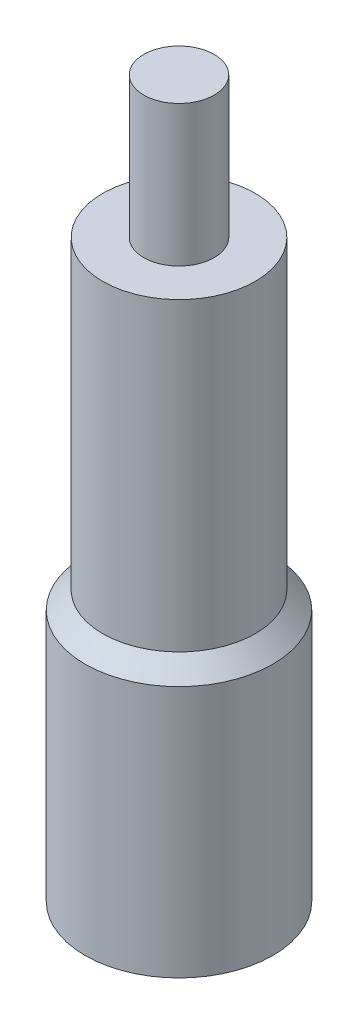
from build123d import *

# Parameters (mm, degrees)
SKETCH_1_R             = 4
EXTRUDE_1_DEPTH        = 24.5
SKETCH_2_R             = 1.5
EXTRUDE_2_DEPTH        = 6
HOLE_WIZARD_M5_1_D     = 4.2
HOLE_WIZARD_M5_1_DEPTH = 10
HOLE_WIZARD_M5_1_TIP   = 1.2618073
SKETCH_5_OUTSIDE_W     = 16.506
SKETCH_5_OUTSIDE_H     = 16.506
SKETCH_5_OUTSIDE_R     = 3.25
CUT_EXTRUDE_1_DEPTH    = 13
CHAMFER_1_SIZE         = 0.75


with BuildPart() as part:
    # 草图1 → 凸台-拉伸1 (new body)
    with BuildSketch(Plane(origin=(0, 0, 0), x_dir=(1, 0, 0), z_dir=(0, 1, 0))):
        with Locations(Location((0, 0, 0), (0, 0, 270))):
            Circle(SKETCH_1_R)
    extrude(amount=EXTRUDE_1_DEPTH)

    # 草图2 → 凸台-拉伸2 (add)
    with BuildSketch(Plane(origin=(0, 24.5, 0), x_dir=(1, 0, 0), z_dir=(0, 1, 0))):
        with Locations(Location((0, 0, 0), (0, 0, 270))):
            Circle(SKETCH_2_R)
    extrude(amount=EXTRUDE_2_DEPTH)

    # M5 螺纹孔1
    with Locations(Plane(origin=(0, 0, 0), x_dir=(-1, 0, 0), z_dir=(0, -1, 0))):
        with Locations((0, 0)):
            Hole(HOLE_WIZARD_M5_1_D / 2, depth=HOLE_WIZARD_M5_1_DEPTH)
            with Locations((0, 0, -(HOLE_WIZARD_M5_1_DEPTH + HOLE_WIZARD_M5_1_TIP / 2))):  # 118° drill point
                Cone(0, HOLE_WIZARD_M5_1_D / 2, HOLE_WIZARD_M5_1_TIP, mode=Mode.SUBTRACT)

    # 草图5 outside → 切除-拉伸1 (cut)
    with BuildSketch(Plane(origin=(0, 24.5, 0), x_dir=(1, 0, 0), z_dir=(0, 1, 0))):
        Rectangle(SKETCH_5_OUTSIDE_W, SKETCH_5_OUTSIDE_H)
        with Locations(Location((0, 0, 0), (0, 0, 270))):
            Circle(SKETCH_5_OUTSIDE_R, mode=Mode.SUBTRACT)
    extrude(amount=-CUT_EXTRUDE_1_DEPTH, mode=Mode.SUBTRACT)

    # 倒角1
    chamfer_1_edges = [part.edges().sort_by_distance(p)[0] for p in [
        (0, 11.5, -4),
    ]]
    chamfer(chamfer_1_edges, length=CHAMFER_1_SIZE - 0.0001)  # a hair under: the kernel refuses the full size


solid = part.part
